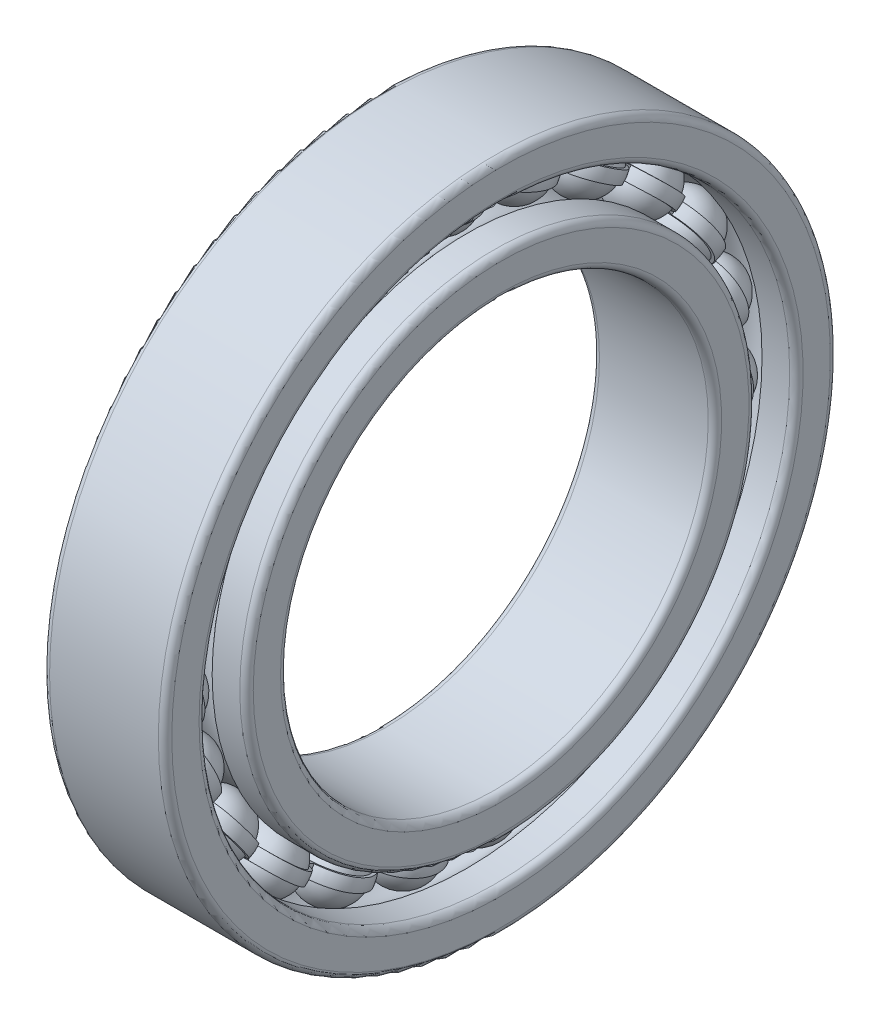
from build123d import *

# Parameters (mm, degrees)
SKETCH_5_W               = 3
SKETCH_5_H               = 2
PATTERN_CIRCULAR_5_COUNT = 23
PATTERN_CIRCULAR_2_COUNT = 23


with BuildPart() as part:
    # 草图2 → 旋转1 (revolve)
    with BuildSketch(Plane.XY):
        with BuildLine():
            Line((8.9, 35), (-8.9, 35))
            ThreePointArc((-8.9, 35), (-9.677817459, 35.322182541), (-10, 36.1))
            Line((-10, 36.1), (-10, 40.566666667))
            ThreePointArc((-10, 40.566666667), (-9.677817459, 41.344484126), (-8.9, 41.666666667))
            Line((-8.9, 41.666666667), (-3.726779963, 41.666666667))
            ThreePointArc((-3.726779963, 41.666666667), (0, 40), (3.726779963, 41.666666667))
            Line((3.726779963, 41.666666667), (8.9, 41.666666667))
            ThreePointArc((8.9, 41.666666667), (9.677817459, 41.344484126), (10, 40.566666667))
            Line((10, 40.566666667), (10, 36.1))
            ThreePointArc((10, 36.1), (9.677817459, 35.322182541), (8.9, 35))
        make_face()
        with BuildLine():
            Line((-10, 53.9), (-10, 49.433333333))
            ThreePointArc((-10, 49.433333333), (-9.677817459, 48.655515874), (-8.9, 48.333333333))
            Line((-8.9, 48.333333333), (-3.726779962, 48.333333333))
            ThreePointArc((-3.726779962, 48.333333333), (0, 50), (3.726779962, 48.333333333))
            Line((3.726779962, 48.333333333), (8.9, 48.333333333))
            ThreePointArc((8.9, 48.333333333), (9.677817459, 48.655515874), (10, 49.433333333))
            Line((10, 49.433333333), (10, 53.9))
            ThreePointArc((10, 53.9), (9.677817459, 54.677817459), (8.9, 55))
            Line((8.9, 55), (-8.9, 55))
            ThreePointArc((-8.9, 55), (-9.677817459, 54.677817459), (-10, 53.9))
        make_face()
    revolve(axis=Axis((-3.5, 0, 0), (1, 0, 0)))


with BuildPart() as body_2:
    # 草图5 → 旋转3 (revolve)
    with BuildSketch(Plane.XY):
        with Locations((0, 45)):
            Rectangle(SKETCH_5_W, SKETCH_5_H)
    revolve(axis=Axis((-19.927092192, 0, 0), (1, 0, 0)))



with BuildPart() as body_3:
    # 草图3 → 旋转2 (revolve)
    with BuildSketch(Plane.XY):
        with BuildLine():
            ThreePointArc((5.5, 45), (0, 50.5), (-5.5, 45))
            Line((-5.5, 45), (5.5, 45))
        make_face()
    revolve(axis=Axis((-5.5, 45, 0), (1, 0, 0)))


with BuildPart() as pattern_circular_5_1:
    # 阵列(圆周)5: pattern copy
    add(body_3.part.rotate(Axis((-3.85, 0, 0), (1, 0, 0)), 1 * 360 / PATTERN_CIRCULAR_5_COUNT))


with BuildPart() as pattern_circular_5_2:
    # 阵列(圆周)5: pattern copy
    add(body_3.part.rotate(Axis((-3.85, 0, 0), (1, 0, 0)), 2 * 360 / PATTERN_CIRCULAR_5_COUNT))


with BuildPart() as pattern_circular_5_3:
    # 阵列(圆周)5: pattern copy
    add(body_3.part.rotate(Axis((-3.85, 0, 0), (1, 0, 0)), 3 * 360 / PATTERN_CIRCULAR_5_COUNT))


with BuildPart() as pattern_circular_5_4:
    # 阵列(圆周)5: pattern copy
    add(body_3.part.rotate(Axis((-3.85, 0, 0), (1, 0, 0)), 4 * 360 / PATTERN_CIRCULAR_5_COUNT))


with BuildPart() as pattern_circular_5_5:
    # 阵列(圆周)5: pattern copy
    add(body_3.part.rotate(Axis((-3.85, 0, 0), (1, 0, 0)), 5 * 360 / PATTERN_CIRCULAR_5_COUNT))


with BuildPart() as pattern_circular_5_6:
    # 阵列(圆周)5: pattern copy
    add(body_3.part.rotate(Axis((-3.85, 0, 0), (1, 0, 0)), 6 * 360 / PATTERN_CIRCULAR_5_COUNT))


with BuildPart() as pattern_circular_5_7:
    # 阵列(圆周)5: pattern copy
    add(body_3.part.rotate(Axis((-3.85, 0, 0), (1, 0, 0)), 7 * 360 / PATTERN_CIRCULAR_5_COUNT))


with BuildPart() as pattern_circular_5_8:
    # 阵列(圆周)5: pattern copy
    add(body_3.part.rotate(Axis((-3.85, 0, 0), (1, 0, 0)), 8 * 360 / PATTERN_CIRCULAR_5_COUNT))


with BuildPart() as pattern_circular_5_9:
    # 阵列(圆周)5: pattern copy
    add(body_3.part.rotate(Axis((-3.85, 0, 0), (1, 0, 0)), 9 * 360 / PATTERN_CIRCULAR_5_COUNT))


with BuildPart() as pattern_circular_5_10:
    # 阵列(圆周)5: pattern copy
    add(body_3.part.rotate(Axis((-3.85, 0, 0), (1, 0, 0)), 10 * 360 / PATTERN_CIRCULAR_5_COUNT))


with BuildPart() as pattern_circular_5_11:
    # 阵列(圆周)5: pattern copy
    add(body_3.part.rotate(Axis((-3.85, 0, 0), (1, 0, 0)), 11 * 360 / PATTERN_CIRCULAR_5_COUNT))


with BuildPart() as pattern_circular_5_12:
    # 阵列(圆周)5: pattern copy
    add(body_3.part.rotate(Axis((-3.85, 0, 0), (1, 0, 0)), 12 * 360 / PATTERN_CIRCULAR_5_COUNT))


with BuildPart() as pattern_circular_5_13:
    # 阵列(圆周)5: pattern copy
    add(body_3.part.rotate(Axis((-3.85, 0, 0), (1, 0, 0)), 13 * 360 / PATTERN_CIRCULAR_5_COUNT))


with BuildPart() as pattern_circular_5_14:
    # 阵列(圆周)5: pattern copy
    add(body_3.part.rotate(Axis((-3.85, 0, 0), (1, 0, 0)), 14 * 360 / PATTERN_CIRCULAR_5_COUNT))


with BuildPart() as pattern_circular_5_15:
    # 阵列(圆周)5: pattern copy
    add(body_3.part.rotate(Axis((-3.85, 0, 0), (1, 0, 0)), 15 * 360 / PATTERN_CIRCULAR_5_COUNT))


with BuildPart() as pattern_circular_5_16:
    # 阵列(圆周)5: pattern copy
    add(body_3.part.rotate(Axis((-3.85, 0, 0), (1, 0, 0)), 16 * 360 / PATTERN_CIRCULAR_5_COUNT))


with BuildPart() as pattern_circular_5_17:
    # 阵列(圆周)5: pattern copy
    add(body_3.part.rotate(Axis((-3.85, 0, 0), (1, 0, 0)), 17 * 360 / PATTERN_CIRCULAR_5_COUNT))


with BuildPart() as pattern_circular_5_18:
    # 阵列(圆周)5: pattern copy
    add(body_3.part.rotate(Axis((-3.85, 0, 0), (1, 0, 0)), 18 * 360 / PATTERN_CIRCULAR_5_COUNT))


with BuildPart() as pattern_circular_5_19:
    # 阵列(圆周)5: pattern copy
    add(body_3.part.rotate(Axis((-3.85, 0, 0), (1, 0, 0)), 19 * 360 / PATTERN_CIRCULAR_5_COUNT))


with BuildPart() as pattern_circular_5_20:
    # 阵列(圆周)5: pattern copy
    add(body_3.part.rotate(Axis((-3.85, 0, 0), (1, 0, 0)), 20 * 360 / PATTERN_CIRCULAR_5_COUNT))


with BuildPart() as pattern_circular_5_21:
    # 阵列(圆周)5: pattern copy
    add(body_3.part.rotate(Axis((-3.85, 0, 0), (1, 0, 0)), 21 * 360 / PATTERN_CIRCULAR_5_COUNT))


with BuildPart() as pattern_circular_5_22:
    # 阵列(圆周)5: pattern copy
    add(body_3.part.rotate(Axis((-3.85, 0, 0), (1, 0, 0)), 22 * 360 / PATTERN_CIRCULAR_5_COUNT))


with BuildPart() as cut_revolve_1_tool:
    # 草图6 → 切除-旋转1 (revolve)
    with BuildSketch(Plane.XY):
        with BuildLine():
            Line((-5.408326913, 46), (5.408326913, 46))
            ThreePointArc((5.408326913, 46), (0, 50.5), (-5.408326913, 46))
        make_face()
        with BuildLine():
            Line((-5.408326913, 44), (5.408326913, 44))
            ThreePointArc((5.408326913, 44), (0, 39.5), (-5.408326913, 44))
        make_face()
    revolve(axis=Axis((-19.927092192, 0, 0), (1, 0, 0)))


with BuildPart() as part_1:
    add(part.part)

    # 切除-旋转1: cut by cut_revolve_1_tool
    add(cut_revolve_1_tool.part, mode=Mode.SUBTRACT)


with BuildPart() as body_3_1:
    add(body_3.part)

    # 切除-旋转1: cut by cut_revolve_1_tool
    add(cut_revolve_1_tool.part, mode=Mode.SUBTRACT)


with BuildPart() as pattern_circular_5_1_1:
    add(pattern_circular_5_1.part)

    # 切除-旋转1: cut by cut_revolve_1_tool
    add(cut_revolve_1_tool.part, mode=Mode.SUBTRACT)


with BuildPart() as pattern_circular_5_2_1:
    add(pattern_circular_5_2.part)

    # 切除-旋转1: cut by cut_revolve_1_tool
    add(cut_revolve_1_tool.part, mode=Mode.SUBTRACT)


with BuildPart() as pattern_circular_5_3_1:
    add(pattern_circular_5_3.part)

    # 切除-旋转1: cut by cut_revolve_1_tool
    add(cut_revolve_1_tool.part, mode=Mode.SUBTRACT)


with BuildPart() as pattern_circular_5_4_1:
    add(pattern_circular_5_4.part)

    # 切除-旋转1: cut by cut_revolve_1_tool
    add(cut_revolve_1_tool.part, mode=Mode.SUBTRACT)


with BuildPart() as pattern_circular_5_5_1:
    add(pattern_circular_5_5.part)

    # 切除-旋转1: cut by cut_revolve_1_tool
    add(cut_revolve_1_tool.part, mode=Mode.SUBTRACT)


with BuildPart() as pattern_circular_5_6_1:
    add(pattern_circular_5_6.part)

    # 切除-旋转1: cut by cut_revolve_1_tool
    add(cut_revolve_1_tool.part, mode=Mode.SUBTRACT)


with BuildPart() as pattern_circular_5_7_1:
    add(pattern_circular_5_7.part)

    # 切除-旋转1: cut by cut_revolve_1_tool
    add(cut_revolve_1_tool.part, mode=Mode.SUBTRACT)


with BuildPart() as pattern_circular_5_8_1:
    add(pattern_circular_5_8.part)

    # 切除-旋转1: cut by cut_revolve_1_tool
    add(cut_revolve_1_tool.part, mode=Mode.SUBTRACT)


with BuildPart() as pattern_circular_5_9_1:
    add(pattern_circular_5_9.part)

    # 切除-旋转1: cut by cut_revolve_1_tool
    add(cut_revolve_1_tool.part, mode=Mode.SUBTRACT)


with BuildPart() as pattern_circular_5_10_1:
    add(pattern_circular_5_10.part)

    # 切除-旋转1: cut by cut_revolve_1_tool
    add(cut_revolve_1_tool.part, mode=Mode.SUBTRACT)


with BuildPart() as pattern_circular_5_11_1:
    add(pattern_circular_5_11.part)

    # 切除-旋转1: cut by cut_revolve_1_tool
    add(cut_revolve_1_tool.part, mode=Mode.SUBTRACT)


with BuildPart() as pattern_circular_5_12_1:
    add(pattern_circular_5_12.part)

    # 切除-旋转1: cut by cut_revolve_1_tool
    add(cut_revolve_1_tool.part, mode=Mode.SUBTRACT)


with BuildPart() as pattern_circular_5_13_1:
    add(pattern_circular_5_13.part)

    # 切除-旋转1: cut by cut_revolve_1_tool
    add(cut_revolve_1_tool.part, mode=Mode.SUBTRACT)


with BuildPart() as pattern_circular_5_14_1:
    add(pattern_circular_5_14.part)

    # 切除-旋转1: cut by cut_revolve_1_tool
    add(cut_revolve_1_tool.part, mode=Mode.SUBTRACT)


with BuildPart() as pattern_circular_5_15_1:
    add(pattern_circular_5_15.part)

    # 切除-旋转1: cut by cut_revolve_1_tool
    add(cut_revolve_1_tool.part, mode=Mode.SUBTRACT)


with BuildPart() as pattern_circular_5_16_1:
    add(pattern_circular_5_16.part)

    # 切除-旋转1: cut by cut_revolve_1_tool
    add(cut_revolve_1_tool.part, mode=Mode.SUBTRACT)


with BuildPart() as pattern_circular_5_17_1:
    add(pattern_circular_5_17.part)

    # 切除-旋转1: cut by cut_revolve_1_tool
    add(cut_revolve_1_tool.part, mode=Mode.SUBTRACT)


with BuildPart() as pattern_circular_5_18_1:
    add(pattern_circular_5_18.part)

    # 切除-旋转1: cut by cut_revolve_1_tool
    add(cut_revolve_1_tool.part, mode=Mode.SUBTRACT)


with BuildPart() as pattern_circular_5_19_1:
    add(pattern_circular_5_19.part)

    # 切除-旋转1: cut by cut_revolve_1_tool
    add(cut_revolve_1_tool.part, mode=Mode.SUBTRACT)


with BuildPart() as pattern_circular_5_20_1:
    add(pattern_circular_5_20.part)

    # 切除-旋转1: cut by cut_revolve_1_tool
    add(cut_revolve_1_tool.part, mode=Mode.SUBTRACT)


with BuildPart() as pattern_circular_5_21_1:
    add(pattern_circular_5_21.part)

    # 切除-旋转1: cut by cut_revolve_1_tool
    add(cut_revolve_1_tool.part, mode=Mode.SUBTRACT)


with BuildPart() as pattern_circular_5_22_1:
    add(pattern_circular_5_22.part)

    # 切除-旋转1: cut by cut_revolve_1_tool
    add(cut_revolve_1_tool.part, mode=Mode.SUBTRACT)


with BuildPart() as body_2_1:
    add(body_2.part)

    add(body_3_1.part)  # 旋转4 merges body 3
    # 草图7 → 旋转4 (revolve)
    with BuildSketch(Plane.XY):
        with BuildLine():
            Line((-5, 45), (5, 45))
            ThreePointArc((5, 45), (0, 50), (-5, 45))
        make_face()
    revolve_4 = revolve(axis=Axis((-5, 45, 0), (1, 0, 0)))

    # 阵列(圆周)2: 旋转4 ×23 about axis
    pattern_circular_2_axis = Axis((-3.85, 0, 0), (1, 0, 0))
    for i in range(1, PATTERN_CIRCULAR_2_COUNT):
        add(revolve_4.rotate(pattern_circular_2_axis, i * 360 / PATTERN_CIRCULAR_2_COUNT))


solid = Compound([part_1.part, pattern_circular_5_1_1.part, pattern_circular_5_2_1.part, pattern_circular_5_3_1.part, pattern_circular_5_4_1.part, pattern_circular_5_5_1.part, pattern_circular_5_6_1.part, pattern_circular_5_7_1.part, pattern_circular_5_8_1.part, pattern_circular_5_9_1.part, pattern_circular_5_10_1.part, pattern_circular_5_11_1.part, pattern_circular_5_12_1.part, pattern_circular_5_13_1.part, pattern_circular_5_14_1.part, pattern_circular_5_15_1.part, pattern_circular_5_16_1.part, pattern_circular_5_17_1.part, pattern_circular_5_18_1.part, pattern_circular_5_19_1.part, pattern_circular_5_20_1.part, pattern_circular_5_21_1.part, pattern_circular_5_22_1.part, body_2_1.part])
